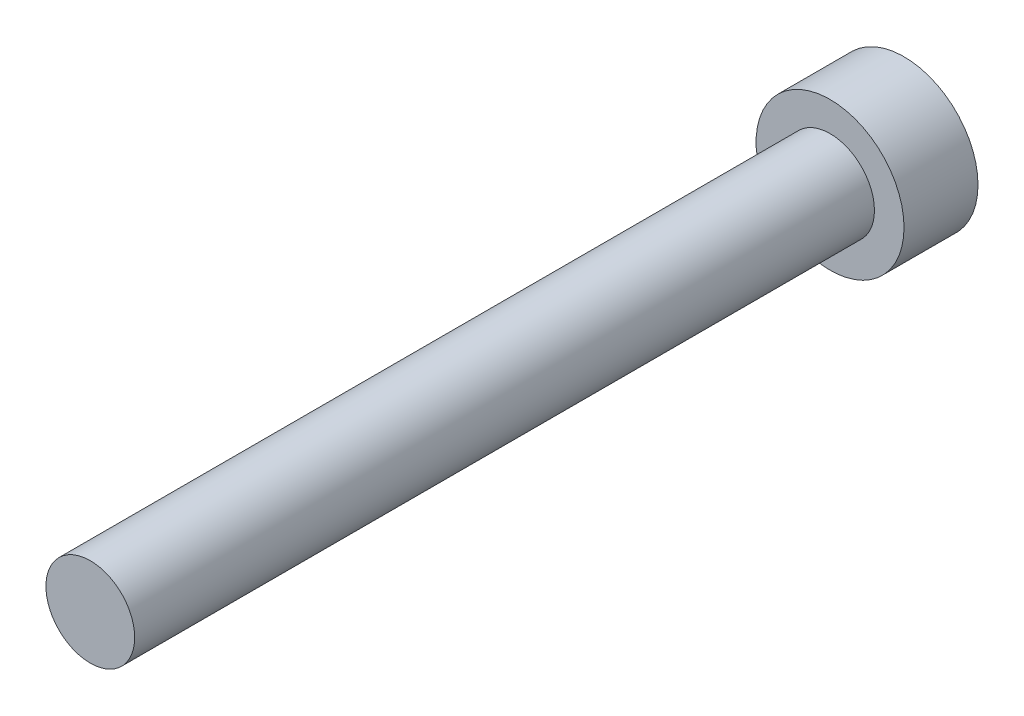
from build123d import *

# Parameters (mm, degrees)
SKETCH1_R           = 2.5
BOSS_EXTRUDE3_DEPTH = 2.5
SKETCH1_3_R         = 1.5
BOSS_EXTRUDE4_DEPTH = 25


with BuildPart() as part:
    # Sketch1 → Boss-Extrude3 (new body)
    with BuildSketch(Plane.XY):
        Circle(SKETCH1_R)
    extrude(amount=-BOSS_EXTRUDE3_DEPTH)

    # Sketch1<3> → Boss-Extrude4 (add)
    with BuildSketch(Plane.XY):
        Circle(SKETCH1_3_R)
    extrude(amount=BOSS_EXTRUDE4_DEPTH)


solid = part.part
